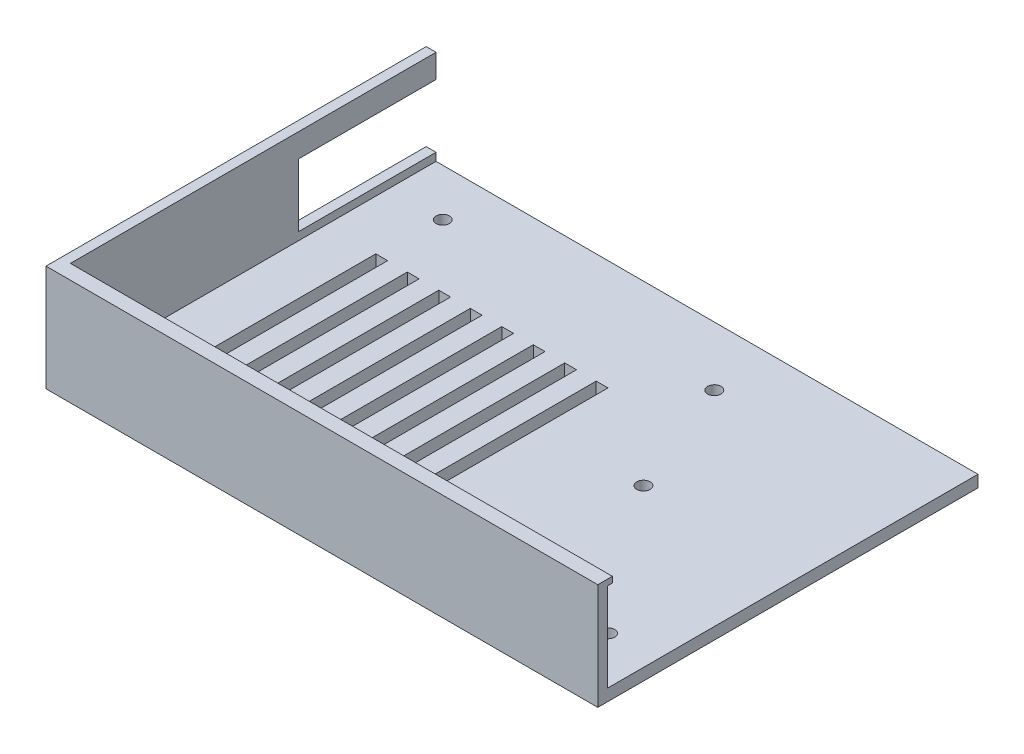
from build123d import *

# Parameters (mm, degrees)
SKETCH1_W                     = 280.4
SKETCH1_H                     = 193.2
SHELL_BLOCK_DEPTH             = 27
SKETCH2_W                     = 275.4
SKETCH2_H                     = 185.8
FRONT_OPENING_DEPTH           = 1.5
SKETCH3_W                     = 275.4
SKETCH3_H                     = 188.2
DISPLAY_POCKET_DEPTH          = 22.5
SKETCH4_W                     = 3
SKETCH4_H                     = 56
VENT_SLOTS_DEPTH              = 4
SKETCH5_W                     = 70
SKETCH5_H                     = 16
CABLE_EXIT_X_SHORT_SIDE_DEPTH = 141.2
SKETCH6_R                     = 1.7
BOLT_HOLES_DEPTH              = 4
KEEP_ONE_HALF_X_DEPTH         = 173.385034153
KEEP_ONE_HALF_X_DEPTH_BACK    = 173.385034153
SKETCH7_W                     = 200
SKETCH7_H                     = 400
KEEP_ONE_QUARTER_Z_DEPTH      = 173.385034153
KEEP_ONE_QUARTER_Z_DEPTH_BACK = 173.385034153
SKETCH8_W                     = 400
SKETCH8_H                     = 200


with BuildPart() as part:
    # Sketch1 → Shell Block (new body)
    with BuildSketch(Plane(origin=(0, 0, 0), x_dir=(1, 0, 0), z_dir=(0, 1, 0))):
        Rectangle(SKETCH1_W, SKETCH1_H)
    extrude(amount=SHELL_BLOCK_DEPTH)

    # Sketch2 → Front Opening (cut)
    with BuildSketch(Plane(origin=(0, 27, 0), x_dir=(1, 0, 0), z_dir=(0, 1, 0))):
        Rectangle(SKETCH2_W, SKETCH2_H)
    extrude(amount=-FRONT_OPENING_DEPTH, mode=Mode.SUBTRACT)

    # Sketch3 → Display Pocket (cut)
    with BuildSketch(Plane(origin=(0, 25.5, 0), x_dir=(1, 0, 0), z_dir=(0, 1, 0))):
        Rectangle(SKETCH3_W, SKETCH3_H)
    extrude(amount=-DISPLAY_POCKET_DEPTH, mode=Mode.SUBTRACT)

    # Sketch4 → Vent Slots (cut)
    with BuildSketch(Plane(origin=(0, 3, 0), x_dir=(1, 0, 0), z_dir=(0, 1, 0))):
        with Locations((-67.5, 56)):
            Rectangle(SKETCH4_W, SKETCH4_H)
        with Locations((-67.5, -56)):
            Rectangle(SKETCH4_W, SKETCH4_H)
        with Locations((-75.5, 56)):
            Rectangle(SKETCH4_W, SKETCH4_H)
        with Locations((-75.5, -56)):
            Rectangle(SKETCH4_W, SKETCH4_H)
        with Locations((-83.5, 56)):
            Rectangle(SKETCH4_W, SKETCH4_H)
        with Locations((-83.5, -56)):
            Rectangle(SKETCH4_W, SKETCH4_H)
        with Locations((-91.5, 56)):
            Rectangle(SKETCH4_W, SKETCH4_H)
        with Locations((-91.5, -56)):
            Rectangle(SKETCH4_W, SKETCH4_H)
        with Locations((-99.5, 56)):
            Rectangle(SKETCH4_W, SKETCH4_H)
        with Locations((-99.5, -56)):
            Rectangle(SKETCH4_W, SKETCH4_H)
        with Locations((-107.5, 56)):
            Rectangle(SKETCH4_W, SKETCH4_H)
        with Locations((-107.5, -56)):
            Rectangle(SKETCH4_W, SKETCH4_H)
        with Locations((-115.5, 56)):
            Rectangle(SKETCH4_W, SKETCH4_H)
        with Locations((-115.5, -56)):
            Rectangle(SKETCH4_W, SKETCH4_H)
        with Locations((-123.5, 56)):
            Rectangle(SKETCH4_W, SKETCH4_H)
        with Locations((-123.5, -56)):
            Rectangle(SKETCH4_W, SKETCH4_H)
    extrude(amount=-VENT_SLOTS_DEPTH, mode=Mode.SUBTRACT)

    # Sketch5 → Cable Exit (-X short side) (cut)
    with BuildSketch(Plane(origin=(0, 0, 0), x_dir=(0, 0, -1), z_dir=(1, 0, 0))):
        with Locations((0, 13)):
            Rectangle(SKETCH5_W, SKETCH5_H)
    extrude(amount=-CABLE_EXIT_X_SHORT_SIDE_DEPTH, mode=Mode.SUBTRACT)

    # Sketch6 → Bolt Holes (cut)
    with BuildSketch(Plane(origin=(0, 3, 0), x_dir=(1, 0, 0), z_dir=(0, 1, 0))):
        with Locations((-40, -45)):
            Circle(SKETCH6_R)
        with Locations((-40, 45)):
            Circle(SKETCH6_R)
        with Locations((40, -45)):
            Circle(SKETCH6_R)
        with Locations((40, 45)):
            Circle(SKETCH6_R)
        with Locations((-52, -15)):
            Circle(SKETCH6_R)
        with Locations((-52, 15)):
            Circle(SKETCH6_R)
        with Locations((52, -15)):
            Circle(SKETCH6_R)
        with Locations((52, 15)):
            Circle(SKETCH6_R)
        with Locations((-12, -82)):
            Circle(SKETCH6_R)
        with Locations((-12, 82)):
            Circle(SKETCH6_R)
        with Locations((12, -82)):
            Circle(SKETCH6_R)
        with Locations((12, 82)):
            Circle(SKETCH6_R)
        with Locations((-124, -12)):
            Circle(SKETCH6_R)
        with Locations((-124, 12)):
            Circle(SKETCH6_R)
        with Locations((124, -12)):
            Circle(SKETCH6_R)
        with Locations((124, 12)):
            Circle(SKETCH6_R)
    extrude(amount=-BOLT_HOLES_DEPTH, mode=Mode.SUBTRACT)

    # Sketch7 → Keep one half (X) (cut, two sides: drawn at the far end of the back side and taken through both)
    with BuildSketch(Plane(origin=(0, 0, 0), x_dir=(1, 0, 0), z_dir=(0, 1, 0)).offset(-KEEP_ONE_HALF_X_DEPTH_BACK)):
        with Locations((100, 0)):
            Rectangle(SKETCH7_W, SKETCH7_H)
    extrude(amount=KEEP_ONE_HALF_X_DEPTH + KEEP_ONE_HALF_X_DEPTH_BACK, mode=Mode.SUBTRACT)

    # Sketch8 → Keep one quarter (Z) (cut, two sides: drawn at the far end of the back side and taken through both)
    with BuildSketch(Plane(origin=(0, 0, 0), x_dir=(1, 0, 0), z_dir=(0, 1, 0)).offset(-KEEP_ONE_QUARTER_Z_DEPTH_BACK)):
        with Locations((0, 100)):
            Rectangle(SKETCH8_W, SKETCH8_H)
    extrude(amount=KEEP_ONE_QUARTER_Z_DEPTH + KEEP_ONE_QUARTER_Z_DEPTH_BACK, mode=Mode.SUBTRACT)


solid = part.part
